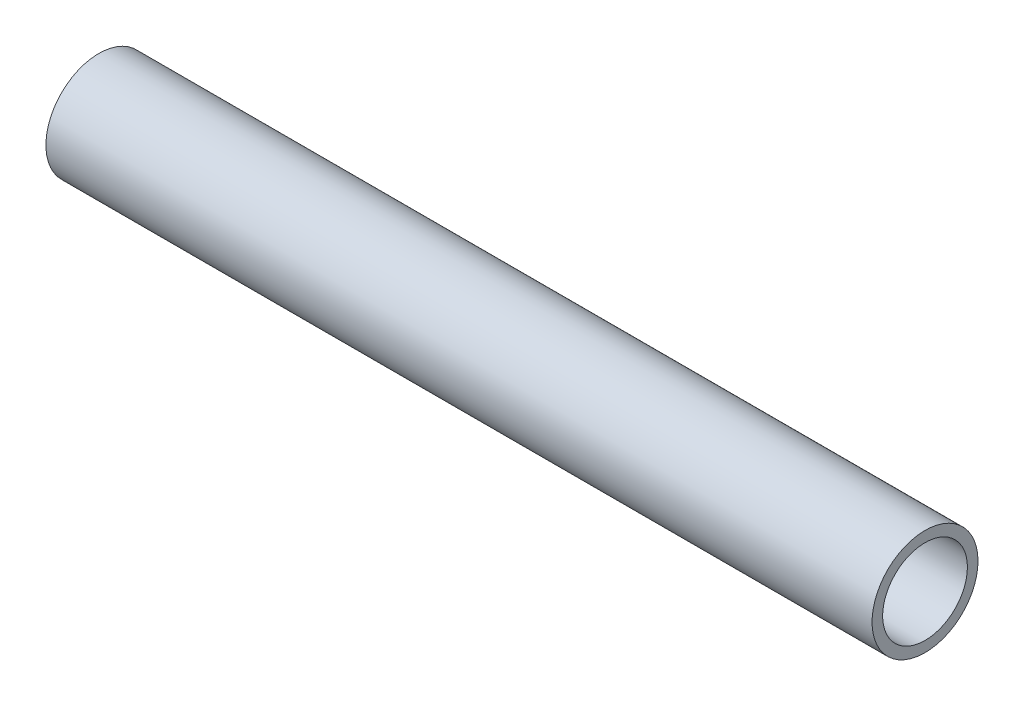
from build123d import *

# Parameters (mm, degrees)
SKETCH1_R           = 15.875
SKETCH1_R_2         = 12.7
EXTRUDE_THIN1_DEPTH = 123.809125


with BuildPart() as part:
    # Sketch1 → Extrude-Thin1 (new, symmetric)
    with BuildSketch(Plane(origin=(0, 0, 0), x_dir=(0, 0, -1), z_dir=(1, 0, 0))):
        Circle(SKETCH1_R)
        Circle(SKETCH1_R_2, mode=Mode.SUBTRACT)
    extrude(amount=EXTRUDE_THIN1_DEPTH, both=True)


solid = part.part
